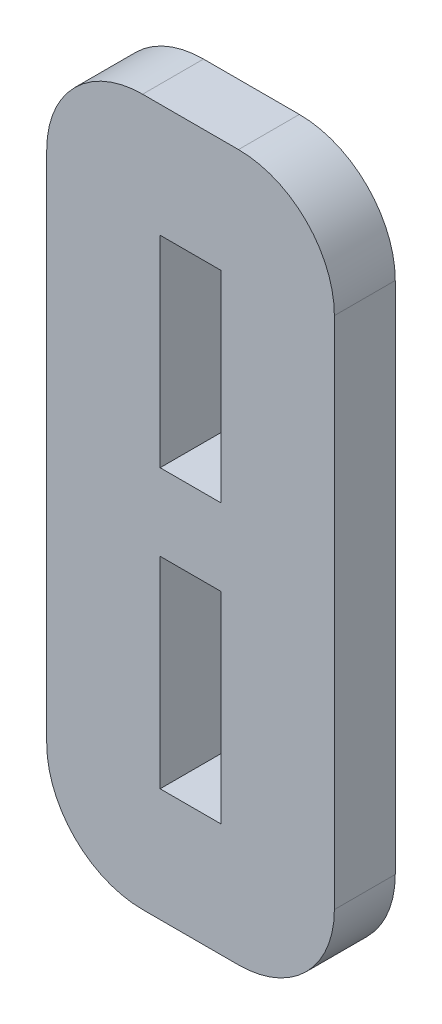
from build123d import *

# Parameters (mm, degrees)
SKETCH1_W           = 15
SKETCH1_H           = 36.825
SKETCH1_W_2         = 3.175
SKETCH1_H_2         = 10.5
BOSS_EXTRUDE1_DEPTH = 3.175
FILLET1_R           = 5


with BuildPart() as part:
    # Sketch1 → Boss-Extrude1 (new body)
    with BuildSketch(Plane.XY):
        with Locations((43.25, 40)):
            Rectangle(SKETCH1_W, SKETCH1_H)
        with Locations((43.25, 32.75)):
            Rectangle(SKETCH1_W_2, SKETCH1_H_2, mode=Mode.SUBTRACT)
        with Locations((43.25, 47.25)):
            Rectangle(SKETCH1_W_2, SKETCH1_H_2, mode=Mode.SUBTRACT)
    extrude(amount=BOSS_EXTRUDE1_DEPTH)

    # Fillet1
    fillet1_edges = [part.edges().sort_by_distance(p)[0] for p in [
        (35.75, 58.4125, 1.5875),
        (50.75, 58.4125, 1.5875),
        (35.75, 21.5875, 1.5875),
        (50.75, 21.5875, 1.5875),
    ]]
    fillet(fillet1_edges, radius=FILLET1_R)


solid = part.part
